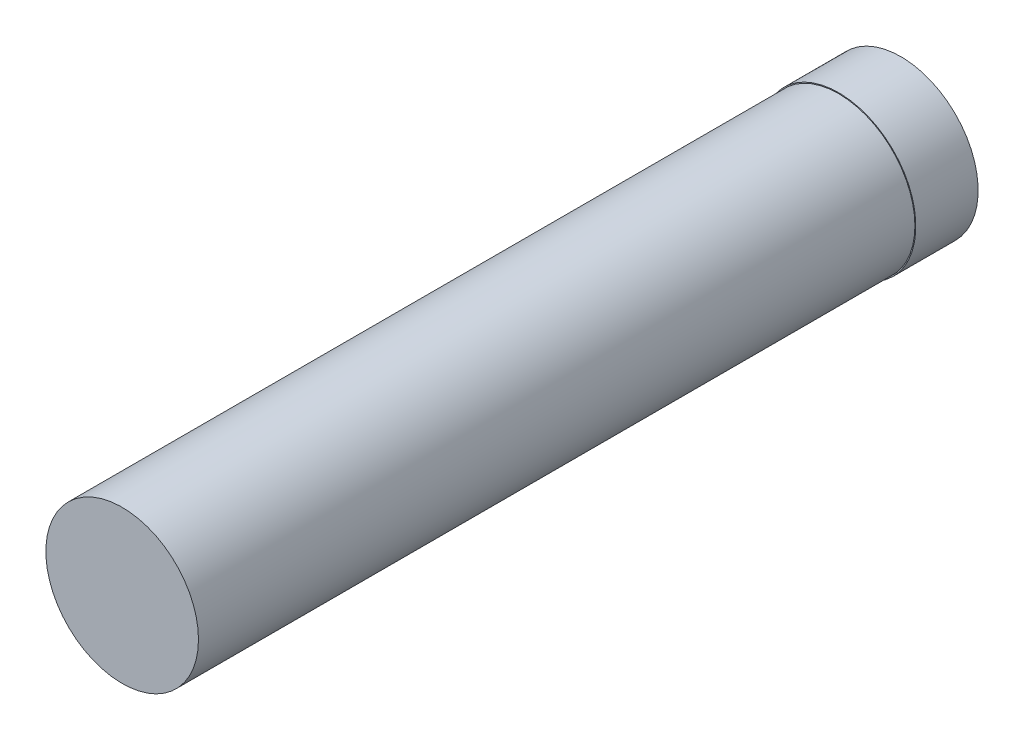
from build123d import *

# Parameters (mm, degrees)
BOSS_EXTRUDE1_DEPTH      = 15
BOSS_EXTRUDE1_DEPTH_BACK = 10
SKETCH1_R                = 2.45
SKETCH3_R                = 2.48
BOSS_EXTRUDE2_DEPTH      = 2


with BuildPart() as part:
    # Sketch1 → Boss-Extrude1 (new, two sides: drawn at the far end of the back side and taken through both)
    with BuildSketch(Plane.XY.offset(-BOSS_EXTRUDE1_DEPTH_BACK)):
        Circle(SKETCH1_R)
    extrude(amount=BOSS_EXTRUDE1_DEPTH + BOSS_EXTRUDE1_DEPTH_BACK)

    # Sketch3 → Boss-Extrude2 (add)
    with BuildSketch(Plane(origin=(0, 0, -10), x_dir=(-1, 0, 0), z_dir=(0, 0, -1))):
        Circle(SKETCH3_R)
    extrude(amount=-BOSS_EXTRUDE2_DEPTH)


solid = part.part
